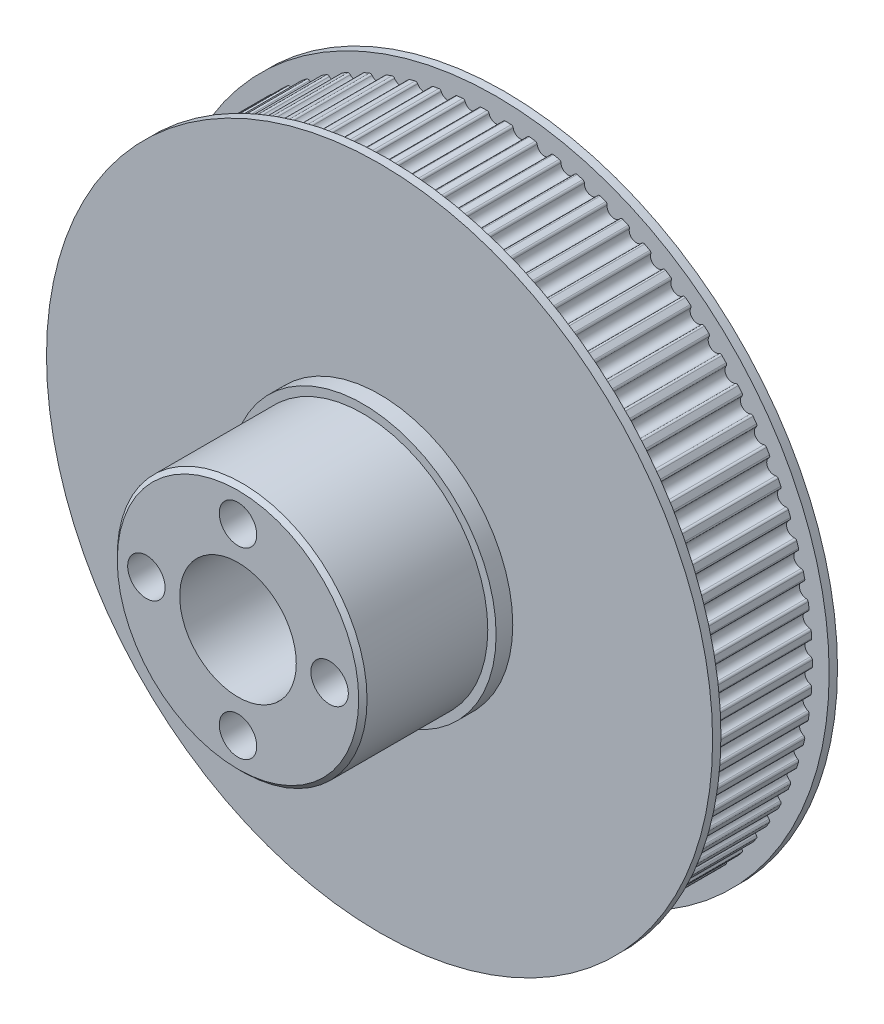
from build123d import *

# Parameters (mm, degrees)
SKETCH1_R           = 37.982116001
BOSS_EXTRUDE1_DEPTH = 7.5
CUT_EXTRUDE1_DEPTH  = 56.769904714
CIRPATTERN1_COUNT   = 82
SKETCH7_R           = 15
BOSS_EXTRUDE4_DEPTH = 17
SKETCH8_R           = 16
BOSS_EXTRUDE5_DEPTH = 2
SKETCH9_R           = 7
SKETCH9_R_2         = 2.25
CUT_EXTRUDE2_DEPTH  = 63.5145841
SKETCH10_R          = 3.6
CUT_EXTRUDE3_DEPTH  = 5
CIRPATTERN2_COUNT   = 4
CHAMFER1_SIZE       = 0.5
SKETCH11_R          = 40
SKETCH11_R_2        = 3.6
SKETCH11_R_3        = 7
BOSS_EXTRUDE6_DEPTH = 1
SKETCH13_R          = 40
SKETCH13_R_2        = 2.25
SKETCH13_R_3        = 7
BOSS_EXTRUDE7_DEPTH = 1


with BuildPart() as part:
    # Sketch1 → Boss-Extrude1 (new, symmetric)
    with BuildSketch(Plane.XY):
        Circle(SKETCH1_R)
    extrude(amount=BOSS_EXTRUDE1_DEPTH, both=True)

    # Sketch2 → Cut-Extrude1 (cut, symmetric)
    with BuildSketch(Plane.XY.offset(7.5)):
        with BuildLine():
            ThreePointArc((-1.103348621, 37.966086942), (-0.938957773, 37.913565471), (-0.843665823, 37.769682531))
            ThreePointArc((-0.843665823, 37.769682531), (0, 37.112116001), (0.843665823, 37.769682531))
            ThreePointArc((0.843665823, 37.769682531), (0.938957773, 37.913565471), (1.103348621, 37.966086942))
            ThreePointArc((1.103348621, 37.966086942), (0, 37.982116001), (-1.103348621, 37.966086942))
        make_face()
    cut_extrude1 = extrude(amount=CUT_EXTRUDE1_DEPTH, both=True, mode=Mode.SUBTRACT)

    # CirPattern1: Cut-Extrude1 ×82 about axis
    cirpattern1_axis = Axis((0, 0, 7.5), (0, 0, -1))
    for i in range(1, CIRPATTERN1_COUNT):
        add(cut_extrude1.rotate(cirpattern1_axis, i * 360 / CIRPATTERN1_COUNT), mode=Mode.SUBTRACT)

    # Sketch7 → Boss-Extrude4 (add)
    with BuildSketch(Plane.XY.offset(7.5)):
        Circle(SKETCH7_R)
    extrude(amount=BOSS_EXTRUDE4_DEPTH)

    # Sketch8 → Boss-Extrude5 (add)
    with BuildSketch(Plane.XY.offset(7.5)):
        Circle(SKETCH8_R)
    extrude(amount=BOSS_EXTRUDE5_DEPTH)

    # Sketch9 → Cut-Extrude2 (cut, through all)
    with BuildSketch(Plane.XY.offset(24.5)):
        Circle(SKETCH9_R)
        with Locations((0, -11)):
            Circle(SKETCH9_R_2)
        with Locations((-11, 0)):
            Circle(SKETCH9_R_2)
        with Locations((0, 11)):
            Circle(SKETCH9_R_2)
        with Locations((11, 0)):
            Circle(SKETCH9_R_2)
    extrude(amount=-CUT_EXTRUDE2_DEPTH, mode=Mode.SUBTRACT)

    # Sketch10 → Cut-Extrude3 (cut)
    with BuildSketch(Plane(origin=(0, 0, -7.5), x_dir=(-1, 0, 0), z_dir=(0, 0, -1))):
        with Locations((11, 0)):
            Circle(SKETCH10_R)
    cut_extrude3 = extrude(amount=-CUT_EXTRUDE3_DEPTH, mode=Mode.SUBTRACT)

    # CirPattern2: Cut-Extrude3 ×4 about axis
    cirpattern2_axis = Axis((0, 0, -7.5), (0, 0, 1))
    for i in range(1, CIRPATTERN2_COUNT):
        add(cut_extrude3.rotate(cirpattern2_axis, i * 360 / CIRPATTERN2_COUNT), mode=Mode.SUBTRACT)

    # Chamfer1
    chamfer1_edges = [part.edges().sort_by_distance(p)[0] for p in [
        (-15, 0, 24.5),
    ]]
    chamfer(chamfer1_edges, length=CHAMFER1_SIZE)

    # Sketch11 → Boss-Extrude6 (add)
    with BuildSketch(Plane(origin=(0, 0, -7.5), x_dir=(-1, 0, 0), z_dir=(0, 0, -1))):
        Circle(SKETCH11_R)
        with Locations((-11, 0)):
            Circle(SKETCH11_R_2, mode=Mode.SUBTRACT)
        with Locations((0, -11)):
            Circle(SKETCH11_R_2, mode=Mode.SUBTRACT)
        with Locations((0, 11)):
            Circle(SKETCH11_R_2, mode=Mode.SUBTRACT)
        Circle(SKETCH11_R_3, mode=Mode.SUBTRACT)
        with Locations((11, 0)):
            Circle(SKETCH11_R_2, mode=Mode.SUBTRACT)
    extrude(amount=-BOSS_EXTRUDE6_DEPTH)

    # Sketch13 → Boss-Extrude7 (add)
    with BuildSketch(Plane.XY.offset(7.5)):
        Circle(SKETCH13_R)
        with Locations((0, 11)):
            Circle(SKETCH13_R_2, mode=Mode.SUBTRACT)
        with Locations((11, 0)):
            Circle(SKETCH13_R_2, mode=Mode.SUBTRACT)
        with Locations((-11, 0)):
            Circle(SKETCH13_R_2, mode=Mode.SUBTRACT)
        with Locations((0, -11)):
            Circle(SKETCH13_R_2, mode=Mode.SUBTRACT)
        Circle(SKETCH13_R_3, mode=Mode.SUBTRACT)
    extrude(amount=-BOSS_EXTRUDE7_DEPTH)


solid = part.part
